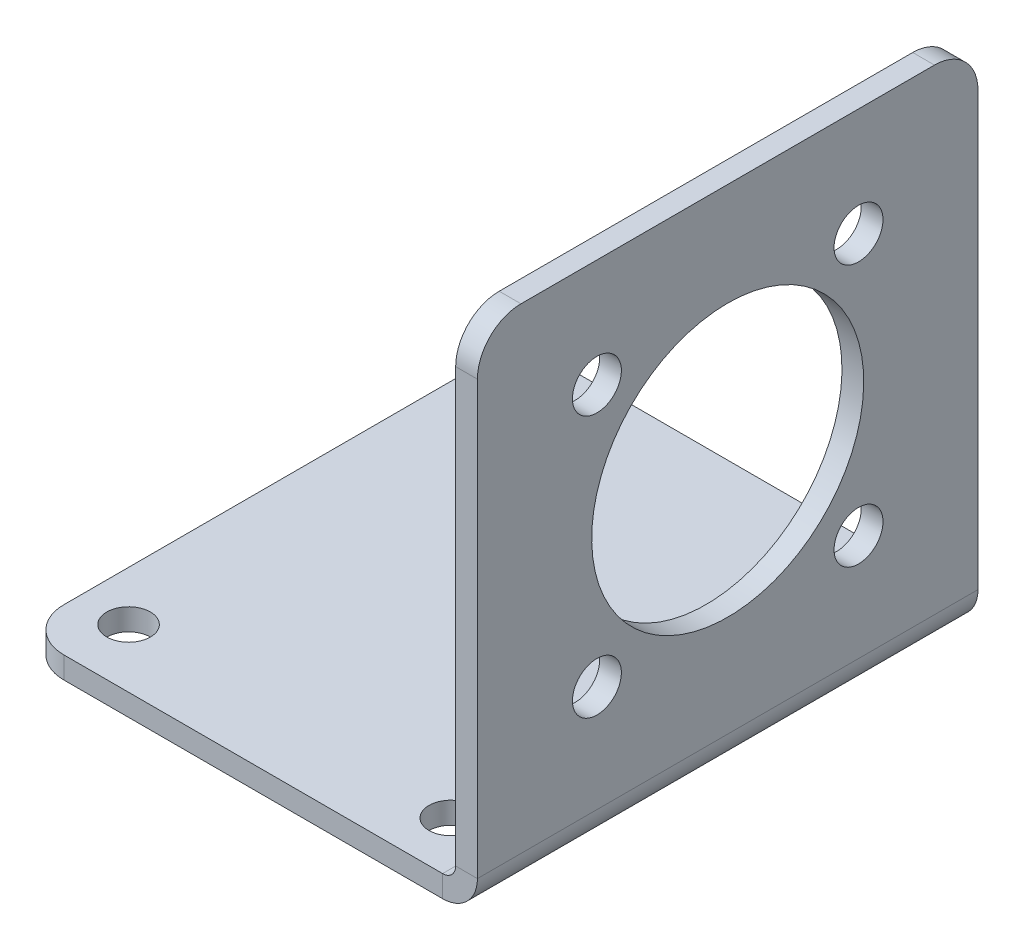
from build123d import *

# Parameters (mm, degrees)
BASE_FLANGE1_DEPTH     = 2
SKETCHED_START         = -23
SKETCHED_BEND1_DEPTH   = 46
SKETCHED_BEND1_2_DEPTH = 46
SKETCH7_R              = 12.5
SKETCH7_R_2            = 2.25
CUT_EXTRUDE1_DEPTH     = 2
SKETCH8_R              = 2
CUT_EXTRUDE2_DEPTH     = 2
FILLET1_R              = 4


# Read off the part's stored shape, not the designer's step: Sketched Bend1
# Sheet-metal steps are written as plain solids
with BuildPart() as part:
    # Sketch1 → Base-Flange1 (new body)
    with BuildSketch(Plane(origin=(0, 0, 0), x_dir=(1, 0, 0), z_dir=(0, 1, 0))):
        Polygon((-20, 23), (20, 23), (66, 23), (66, -23), (20, -23), (-20, -23), align=None)
    extrude(amount=-BASE_FLANGE1_DEPTH)

    # Sketched Bend1 outline → Sketched Bend1 (cut)
    with BuildSketch(Plane.XY.offset(SKETCHED_START)):
        with BuildLine():
            Line((66, 0), (21.766479395, 0))
            ThreePointArc((21.766479395, 0), (20.588854382, -1.453299832), (18.8, -2))
            Line((18.8, -2), (66, -2))
            Line((66, -2), (66, 0))
        make_face()
    extrude(amount=SKETCHED_BEND1_DEPTH, mode=Mode.SUBTRACT)

    # Sketched Bend1 2 outline → Sketched Bend1 2 (add)
    with BuildSketch(Plane.XY.offset(SKETCHED_START)):
        with BuildLine():
            Line((20, 44.944248081), (20, 1.2))
            ThreePointArc((20, 1.2), (19.648528137, 0.351471863), (18.8, 0))
            Line((18.8, 0), (21.766479395, 0))
            ThreePointArc((21.766479395, 0), (21.941077368, 0.58874476), (22, 1.2))
            Line((22, 1.2), (22, 44.944248081))
            Line((22, 44.944248081), (20, 44.944248081))
        make_face()
    extrude(amount=SKETCHED_BEND1_2_DEPTH)

    # Sketch7 → Cut-Extrude1 (cut)
    with BuildSketch(Plane(origin=(22, 0, 0), x_dir=(0, 0, -1), z_dir=(1, 0, 0))):
        with Locations(Location((0, 23, 0), (0, 0, 90))):
            Circle(SKETCH7_R)
        with Locations(Location((12.02081528, 35.02081528, 0), (0, 0, 90))):
            Circle(SKETCH7_R_2)
        with Locations(Location((12.02081528, 10.97918472, 0), (0, 0, 90))):
            Circle(SKETCH7_R_2)
        with Locations(Location((-12.02081528, 10.97918472, 0), (0, 0, 90))):
            Circle(SKETCH7_R_2)
        with Locations(Location((-12.02081528, 35.02081528, 0), (0, 0, 90))):
            Circle(SKETCH7_R_2)
    extrude(amount=-CUT_EXTRUDE1_DEPTH, mode=Mode.SUBTRACT)

    # Sketch8 → Cut-Extrude2 (cut)
    with BuildSketch(Plane(origin=(0, 0, 0), x_dir=(1, 0, 0), z_dir=(0, 1, 0))):
        with Locations(Location((-15.450942979, 17.606788068, 0), (0, 0, 270))):
            Circle(SKETCH8_R)
        with Locations(Location((-15.450942979, -17.606788068, 0), (0, 0, 90))):
            Circle(SKETCH8_R)
        with Locations(Location((14.749785428, 18.198199219, 0), (0, 0, 270))):
            Circle(SKETCH8_R)
        with Locations(Location((14.749785428, -18.198199219, 0), (0, 0, 90))):
            Circle(SKETCH8_R)
    extrude(amount=-CUT_EXTRUDE2_DEPTH, mode=Mode.SUBTRACT)

    # Fillet1
    fillet1_edges = [part.edges().sort_by_distance(p)[0] for p in [
        (21, 44.944248081, -23),
        (21, 44.944248081, 23),
        (-20, -1, 23),
        (-20, -1, -23),
    ]]
    fillet(fillet1_edges, radius=FILLET1_R)


solid = part.part
